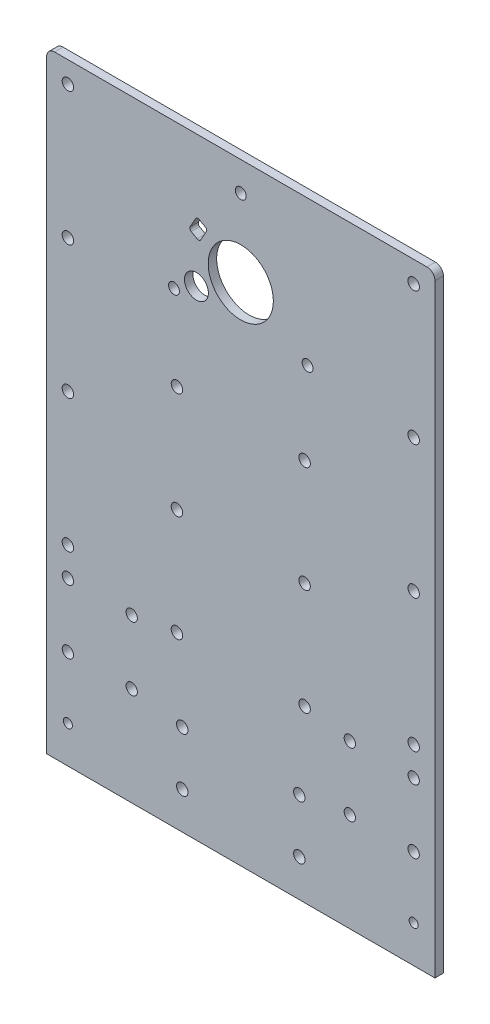
from build123d import *

# Parameters (mm, degrees)
SKETCH1_W           = 146
SKETCH1_H           = 230
SKETCH1_R           = 2.05
SKETCH1_R_2         = 12.25
SKETCH1_R_3         = 2.125
SKETCH1_R_4         = 4.5
SKETCH1_R_5         = 1.7
SKETCH1_R_6         = 2.15
BOSS_EXTRUDE1_DEPTH = 3.175
FILLET1_R           = 1
FILLET2_R           = 3
SKETCH2_R           = 2.15
CUT_EXTRUDE1_DEPTH  = 137.250066514


with BuildPart() as part:
    # Sketch1 → Boss-Extrude1 (new body)
    with BuildSketch(Plane.XY):
        Rectangle(SKETCH1_W, SKETCH1_H)
        with Locations((0, 104)):
            Circle(SKETCH1_R, mode=Mode.SUBTRACT)
        with Locations((25.11473671, 60.5)):
            Circle(SKETCH1_R, mode=Mode.SUBTRACT)
        with Locations((-25.11473671, 60.5)):
            Circle(SKETCH1_R, mode=Mode.SUBTRACT)
        with Locations((0, 75)):
            Circle(SKETCH1_R_2, mode=Mode.SUBTRACT)
        with Locations((-65, -77.85)):
            Circle(SKETCH1_R_3, mode=Mode.SUBTRACT)
        with Locations((-41, -77.85)):
            Circle(SKETCH1_R_3, mode=Mode.SUBTRACT)
        with Locations((-41, -53.85)):
            Circle(SKETCH1_R_3, mode=Mode.SUBTRACT)
        with Locations((-65, -53.85)):
            Circle(SKETCH1_R_3, mode=Mode.SUBTRACT)
        with Locations((41, -77.85)):
            Circle(SKETCH1_R_3, mode=Mode.SUBTRACT)
        with Locations((65, -77.85)):
            Circle(SKETCH1_R_3, mode=Mode.SUBTRACT)
        with Locations((65, -53.85)):
            Circle(SKETCH1_R_3, mode=Mode.SUBTRACT)
        with Locations((41, -53.85)):
            Circle(SKETCH1_R_3, mode=Mode.SUBTRACT)
        with Locations((-16.670989023, 65.375)):
            Circle(SKETCH1_R_4, mode=Mode.SUBTRACT)
        with Locations((-65, -101.025)):
            Circle(SKETCH1_R_5, mode=Mode.SUBTRACT)
        with Locations((65, -101.025)):
            Circle(SKETCH1_R_5, mode=Mode.SUBTRACT)
        with Locations((-65, 107)):
            Circle(SKETCH1_R_6, mode=Mode.SUBTRACT)
        with Locations((-65, 57)):
            Circle(SKETCH1_R_6, mode=Mode.SUBTRACT)
        with Locations((-65, 7)):
            Circle(SKETCH1_R_6, mode=Mode.SUBTRACT)
        with Locations((-65, -43)):
            Circle(SKETCH1_R_6, mode=Mode.SUBTRACT)
        with Locations((65, -43)):
            Circle(SKETCH1_R_6, mode=Mode.SUBTRACT)
        with Locations((65, 7)):
            Circle(SKETCH1_R_6, mode=Mode.SUBTRACT)
        with Locations((65, 57)):
            Circle(SKETCH1_R_6, mode=Mode.SUBTRACT)
        with Locations((65, 107)):
            Circle(SKETCH1_R_6, mode=Mode.SUBTRACT)
        Polygon((-19.516682721, 82.6867329), (-15.492642376, 80.458033884), (-12.488743702, 85.881740435), (-16.512784047, 88.110439451), align=None, mode=Mode.SUBTRACT)
    extrude(amount=BOSS_EXTRUDE1_DEPTH)

    # Fillet1
    fillet1_edges = [part.edges().sort_by_distance(p)[0] for p in [
        (-19.516682721, 82.6867329, 1.5875),
        (-15.492642376, 80.458033884, 1.5875),
        (-12.488743702, 85.881740435, 1.5875),
        (-16.512784047, 88.110439451, 1.5875),
    ]]
    fillet(fillet1_edges, radius=FILLET1_R)

    # Fillet2
    fillet2_edges = [part.edges().sort_by_distance(p)[0] for p in [
        (73, 115, 1.5875),
        (-73, 115, 1.5875),
    ]]
    fillet(fillet2_edges, radius=FILLET2_R)

    # Sketch2 → Cut-Extrude1 (cut, through all)
    with BuildSketch(Plane.XY.offset(3.175)):
        with Locations((-22, -101.025)):
            Circle(SKETCH2_R)
        with Locations((-22, -80.821)):
            Circle(SKETCH2_R)
        with Locations((22, -101.025)):
            Circle(SKETCH2_R)
        with Locations((22, -80.821)):
            Circle(SKETCH2_R)
        with Locations((-24, 29)):
            Circle(SKETCH2_R)
        with Locations((-24, -11)):
            Circle(SKETCH2_R)
        with Locations((-24, -51)):
            Circle(SKETCH2_R)
        with Locations((24, -51)):
            Circle(SKETCH2_R)
        with Locations((24, -11)):
            Circle(SKETCH2_R)
        with Locations((24, 29)):
            Circle(SKETCH2_R)
    extrude(amount=-CUT_EXTRUDE1_DEPTH, mode=Mode.SUBTRACT)


solid = part.part
